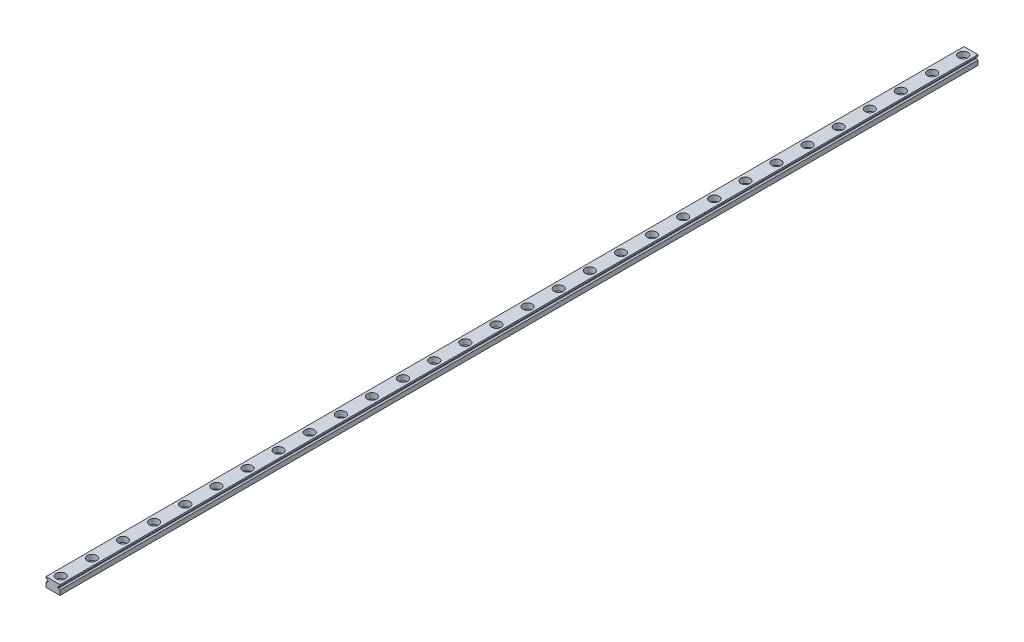
from build123d import *

# Parameters (mm, degrees)
EXTRUDE1_DEPTH  = 590
SKETCH2_R       = 3
EXTRUDE2_DEPTH  = 3.5
SKETCH_R        = 1.75
EXTRUDE3_DEPTH  = 591.047667566
LPATTERN1_COUNT = 30
LPATTERN1_PITCH = 20


with BuildPart() as part:
    # Sketch1 → Extrude1 (new body)
    with BuildSketch(Plane.XY):
        with BuildLine():
            Line((-4.5, -3), (4.5, -3))
            Line((4.5, -3), (4.5, 0))
            ThreePointArc((4.5, 0), (3.93077967, 0.177814974), (3.563991137, 0.648023568))
            Line((3.563991137, 0.648023568), (3.235073025, 0.648023568))
            Line((3.235073025, 0.648023568), (3.235073025, 1.351976432))
            Line((3.235073025, 1.351976432), (3.563991137, 1.351976432))
            ThreePointArc((3.563991137, 1.351976432), (3.93077967, 1.822185026), (4.5, 2))
            Line((4.5, 2), (4.5, 3))
            Line((4.5, 3), (-4.5, 3))
            Line((-4.5, 3), (-4.5, 2))
            ThreePointArc((-4.5, 2), (-3.93077967, 1.822185026), (-3.563991137, 1.351976432))
            Line((-3.563991137, 1.351976432), (-3.235073025, 1.351976432))
            Line((-3.235073025, 1.351976432), (-3.235073025, 0.648023568))
            Line((-3.235073025, 0.648023568), (-3.563991137, 0.648023568))
            ThreePointArc((-3.563991137, 0.648023568), (-3.93077967, 0.177814974), (-4.5, 0))
            Line((-4.5, 0), (-4.5, -3))
        make_face()
    extrude(amount=EXTRUDE1_DEPTH)

    # Sketch2 → Extrude2 (cut)
    with BuildSketch(Plane(origin=(0, 3, 0), x_dir=(1, 0, 0), z_dir=(0, 1, 0))):
        with Locations((0, -5)):
            Circle(SKETCH2_R)
    extrude2 = extrude(amount=-EXTRUDE2_DEPTH, mode=Mode.SUBTRACT)

    # Sketch → Extrude3 (cut, through all)
    with BuildSketch(Plane(origin=(0, 3, 0), x_dir=(1, 0, 0), z_dir=(0, 1, 0))):
        with Locations((0, -5)):
            Circle(SKETCH_R)
    extrude3 = extrude(amount=-EXTRUDE3_DEPTH, mode=Mode.SUBTRACT)

    # LPattern1: Extrude2, Extrude3 ×30
    with Locations(*[(0, 0, i * LPATTERN1_PITCH) for i in range(1, LPATTERN1_COUNT)]):
        add(extrude2, mode=Mode.SUBTRACT)
        add(extrude3, mode=Mode.SUBTRACT)


solid = part.part
